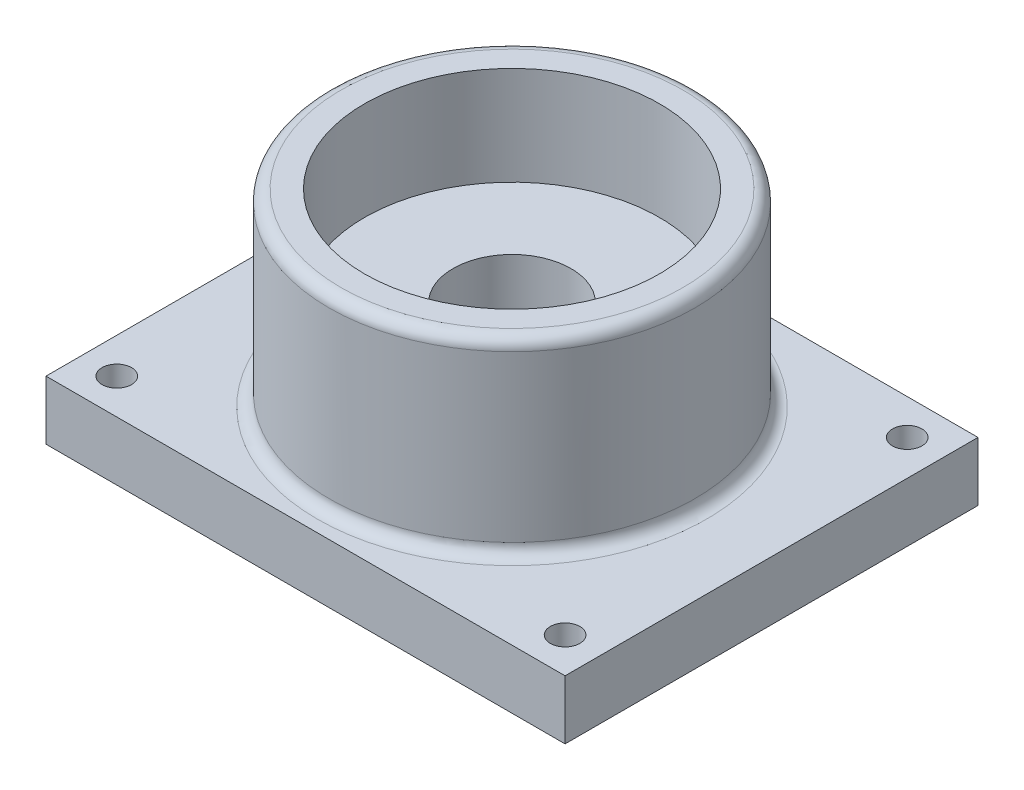
from build123d import *

# Parameters (mm, degrees)
SKETCH1_R           = 15.5
BOSS_EXTRUDE1_DEPTH = 16
SKETCH16_W          = 44
SKETCH16_H          = 35
SKETCH16_R          = 1.25
BOSS_EXTRUDE6_DEPTH = 5
SKETCH17_R          = 9.75
CUT_EXTRUDE5_DEPTH  = 6
SKETCH18_R          = 5
CUT_EXTRUDE7_DEPTH  = 19
FILLET4_R           = 1
FILLET1_R           = 1
FILLET3_R           = 1
SKETCH5_R           = 12.5
CUT_EXTRUDE1_DEPTH  = 8.351951541


with BuildPart() as part:
    # Sketch1 → Boss-Extrude1 (new body)
    with BuildSketch(Plane(origin=(0, 0, 0), x_dir=(1, 0, 0), z_dir=(0, 1, 0))):
        Circle(SKETCH1_R)
    extrude(amount=BOSS_EXTRUDE1_DEPTH)

    # Sketch16 → Boss-Extrude6 (add)
    with BuildSketch(Plane.XZ):
        Rectangle(SKETCH16_W, SKETCH16_H)
        with Locations((-19, 14.5)):
            Circle(SKETCH16_R, mode=Mode.SUBTRACT)
        with Locations((19, 14.5)):
            Circle(SKETCH16_R, mode=Mode.SUBTRACT)
        with Locations((19, -14.5)):
            Circle(SKETCH16_R, mode=Mode.SUBTRACT)
        with Locations((-19, -14.5)):
            Circle(SKETCH16_R, mode=Mode.SUBTRACT)
    extrude(amount=BOSS_EXTRUDE6_DEPTH)

    # Sketch17 → Cut-Extrude5 (cut)
    with BuildSketch(Plane(origin=(0, 16, 0), x_dir=(1, 0, 0), z_dir=(0, 1, 0))):
        Circle(SKETCH17_R)
    extrude(amount=-CUT_EXTRUDE5_DEPTH, mode=Mode.SUBTRACT)

    # Sketch18 → Cut-Extrude7 (cut)
    with BuildSketch(Plane(origin=(0, 10, 0), x_dir=(1, 0, 0), z_dir=(0, 1, 0))):
        Circle(SKETCH18_R)
    extrude(amount=-CUT_EXTRUDE7_DEPTH, mode=Mode.SUBTRACT)

    # Fillet4
    fillet4_edges = [part.edges().sort_by_distance(p)[0] for p in [
        (-15.5, 0, 0),
    ]]
    fillet(fillet4_edges, radius=FILLET4_R)

    # Fillet1
    fillet1_edges = [part.edges().sort_by_distance(p)[0] for p in [
        (-9.75, 16, 0),
    ]]
    fillet(fillet1_edges, radius=FILLET1_R)

    # Fillet3
    fillet3_edges = [part.edges().sort_by_distance(p)[0] for p in [
        (-15.5, 16, 0),
    ]]
    fillet(fillet3_edges, radius=FILLET3_R)

    # Sketch5 → Cut-Extrude1 (cut)
    with BuildSketch(Plane(origin=(0, 16, 0), x_dir=(1, 0, 0), z_dir=(0, 1, 0))):
        Circle(SKETCH5_R)
    extrude(amount=-CUT_EXTRUDE1_DEPTH, mode=Mode.SUBTRACT)


solid = part.part
